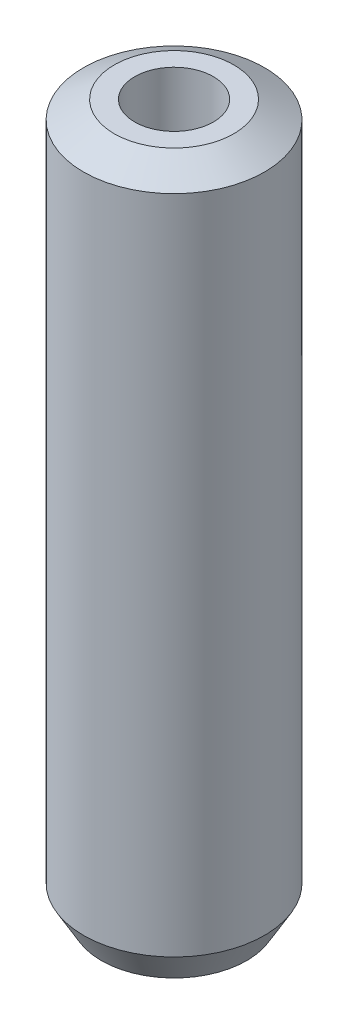
from build123d import *
from OCP.BRepFilletAPI import BRepFilletAPI_MakeChamfer

# Parameters (mm, degrees)
SKETCH1_R           = 20
BOSS_EXTRUDE1_DEPTH = 156.84797852
SKETCH2_R           = 8.694781683
CUT_EXTRUDE1_DEPTH  = 160.377816416
CHAMFER1_SIZE       = 3.923643743
CHAMFER1_SIZE2      = 6.795950314


with BuildPart() as part:
    # Sketch1 → Boss-Extrude1 (new body)
    with BuildSketch(Plane(origin=(0, 0, 0), x_dir=(1, 0, 0), z_dir=(0, 1, 0))):
        Circle(SKETCH1_R)
    extrude(amount=BOSS_EXTRUDE1_DEPTH)

    # Sketch2 → Cut-Extrude1 (cut, through all)
    with BuildSketch(Plane(origin=(0, 0, 0), x_dir=(1, 0, 0), z_dir=(0, 1, 0))):
        Circle(SKETCH2_R)
    extrude(amount=CUT_EXTRUDE1_DEPTH, mode=Mode.SUBTRACT)

    # Chamfer1: one chamfer whose edges measure the first distance from different faces: ONE call of the kernel's chamfer builder (chamfer() names one face for all edges)
    chamfer1_edges_1 = [part.edges().sort_by_distance(p)[0] for p in [
        (-20, 156.84797852, 0),
    ]]
    chamfer1_side_1 = [part.faces().sort_by_distance(p)[0] for p in [
        (-20, 78.42398926, 0),
    ]]
    chamfer1_edges_2 = [part.edges().sort_by_distance(p)[0] for p in [
        (-20, 0, 0),
    ]]
    chamfer1_side_2 = [part.faces().sort_by_distance(p)[0] for p in [
        (-19.434314575, 0, 0),
    ]]
    chamfer1 = BRepFilletAPI_MakeChamfer(part.part.solid().wrapped)
    for e in chamfer1_edges_1:
        chamfer1.Add(CHAMFER1_SIZE, CHAMFER1_SIZE2, e.wrapped, chamfer1_side_1[0].wrapped)  # the first distance lies on this face
    for e in chamfer1_edges_2:
        chamfer1.Add(CHAMFER1_SIZE, CHAMFER1_SIZE2, e.wrapped, chamfer1_side_2[0].wrapped)  # the first distance lies on this face
    add(Compound.cast(chamfer1.Shape()), mode=Mode.REPLACE)


solid = part.part
